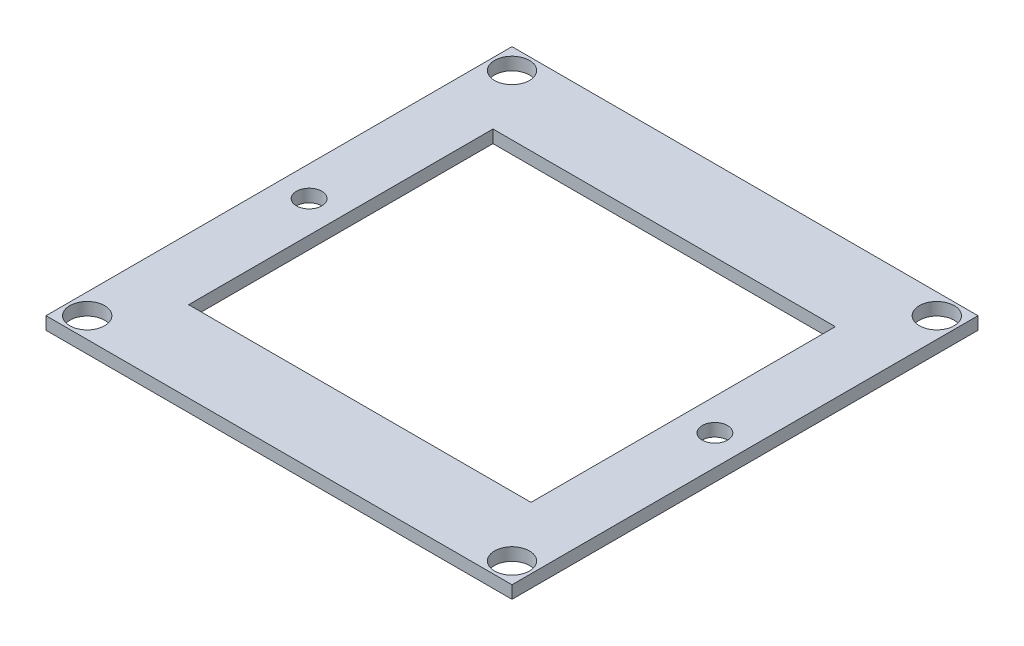
from build123d import *

# Parameters (mm, degrees)
SKETCH1_W               = 294
SKETCH1_H               = 294
SKETCH1_W_2             = 216
SKETCH1_H_2             = 192
BOSS_EXTRUDE1_DEPTH     = 8
SKETCH2_R               = 11
CUT_EXTRUDE1_DEPTH      = 209.043264731
SKETCH4_R               = 8
CUT_EXTRUDE2_DEPTH      = 209.043264731
MIRROR3_COPY_1_SKETCH_R = 11
MIRROR3_COPY_1_DEPTH    = 209.043264731


with BuildPart() as part:
    # Sketch1 → Boss-Extrude1 (new body)
    with BuildSketch(Plane(origin=(0, 0, 0), x_dir=(1, 0, 0), z_dir=(0, 1, 0))):
        Rectangle(SKETCH1_W, SKETCH1_H)
        Rectangle(SKETCH1_W_2, SKETCH1_H_2, mode=Mode.SUBTRACT)
    extrude(amount=BOSS_EXTRUDE1_DEPTH)

    # Sketch2 → Cut-Extrude1 (cut, through all)
    with BuildSketch(Plane(origin=(0, 0, 0), x_dir=(1, 0, 0), z_dir=(0, 1, 0))):
        with Locations((134, 134)):
            Circle(SKETCH2_R)
    cut_extrude1 = extrude(amount=CUT_EXTRUDE1_DEPTH, mode=Mode.SUBTRACT)

    # Mirror2: Cut-Extrude1 across plane
    add(cut_extrude1.mirror(Plane.XY), mode=Mode.SUBTRACT)

    # Sketch4 → Cut-Extrude2 (cut, through all)
    with BuildSketch(Plane(origin=(0, 8, 0), x_dir=(1, 0, 0), z_dir=(0, 1, 0))):
        with Locations((128, 0)):
            Circle(SKETCH4_R)
    cut_extrude2 = extrude(amount=-CUT_EXTRUDE2_DEPTH, mode=Mode.SUBTRACT)

    # Mirror3: Cut-Extrude1 across plane
    add(cut_extrude1.mirror(Plane(origin=(0, 0, 0), x_dir=(0, 0, 1), z_dir=(1, 0, 0))), mode=Mode.SUBTRACT)

    # Mirror3 copy 1 sketch → Mirror3 copy 1 (cut, through all)
    with BuildSketch(Plane(origin=(0, 0, 0), x_dir=(-1, 0, 0), z_dir=(0, 1, 0))):
        with Locations((134, 134)):
            Circle(MIRROR3_COPY_1_SKETCH_R)
    extrude(amount=MIRROR3_COPY_1_DEPTH, mode=Mode.SUBTRACT)

    # Mirror4: Cut-Extrude2 across plane
    add(cut_extrude2.mirror(Plane(origin=(0, 0, 0), x_dir=(0, 0, 1), z_dir=(1, 0, 0))), mode=Mode.SUBTRACT)


solid = part.part
